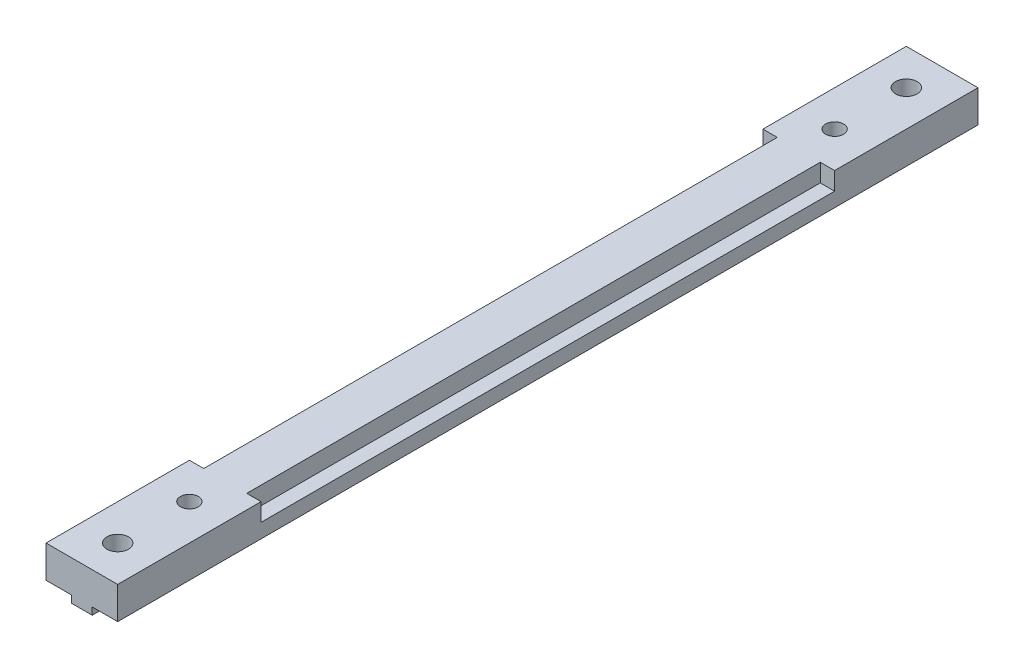
from build123d import *

# Parameters (mm, degrees)
MAIN_DEPTH      = 120
SKETCH2_R       = 1.25
SKETCH2_R_2     = 1.5
MAINHOLES_DEPTH = 121.22998794
SKETCH3_W       = 2
SKETCH3_H       = 80
PINHOLES_DEPTH  = 2.5


with BuildPart() as part:
    # Sketch1 → Main (new body)
    with BuildSketch(Plane.XY):
        Polygon((-5, 0), (5, 0), (5, -4.5), (1.45, -4.5), (1.45, -5.5), (-1.45, -5.5), (-1.45, -4.5), (-5, -4.5), align=None)
    extrude(amount=MAIN_DEPTH)

    # Sketch2 → MainHoles (cut, through all)
    with BuildSketch(Plane(origin=(0, 0, 0), x_dir=(1, 0, 0), z_dir=(0, 1, 0))):
        with Locations((0, -105)):
            Circle(SKETCH2_R)
        with Locations((0, -15)):
            Circle(SKETCH2_R)
        with Locations((0, -5)):
            Circle(SKETCH2_R_2)
        with Locations((0, -115)):
            Circle(SKETCH2_R_2)
    extrude(amount=-MAINHOLES_DEPTH, mode=Mode.SUBTRACT)

    # Sketch3 → PinHoles (cut)
    with BuildSketch(Plane(origin=(0, 0, 0), x_dir=(1, 0, 0), z_dir=(0, 1, 0))):
        with Locations((-4, -60)):
            Rectangle(SKETCH3_W, SKETCH3_H)
        with Locations((4, -60)):
            Rectangle(SKETCH3_W, SKETCH3_H)
    extrude(amount=-PINHOLES_DEPTH, mode=Mode.SUBTRACT)


solid = part.part
